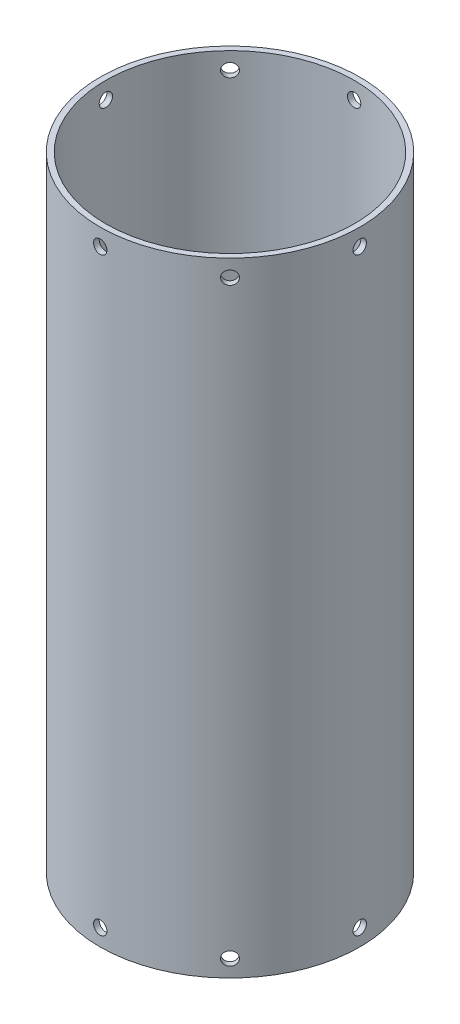
from build123d import *

# Parameters (mm, degrees)
SKETCH1_R               = 97.52457
SKETCH1_R_2             = 93.298518
BOSS_EXTRUDE1_DEPTH     = 467.995
CUT_EXTRUDE1_REACH      = 465.586
CUT_EXTRUDE1_END_RADIUS = 97.52457
SKETCH4_R               = 5.0165
CIRPATTERN3_COUNT       = 8
CUT_EXTRUDE2_REACH      = 465.586
CUT_EXTRUDE2_END_RADIUS = 97.52457
SKETCH7_R               = 5.0165
CIRPATTERN4_COUNT       = 8
SCALE1_SCALE            = 0.390667


with BuildPart() as part:
    # Sketch1 → Boss-Extrude1 (new body)
    with BuildSketch(Plane(origin=(0, 0, 0), x_dir=(1, 0, 0), z_dir=(0, 1, 0))):
        with Locations(Location((0, 0, 0), (0, 0, 270))):
            Circle(SKETCH1_R)
        with Locations(Location((0, 0, 0), (0, 0, 270))):
            Circle(SKETCH1_R_2, mode=Mode.SUBTRACT)
    extrude(amount=BOSS_EXTRUDE1_DEPTH)

    # Cut-Extrude1: up to this cylinder (the profile starts inside it)
    cut_extrude1_end = Plane(origin=(0, 455.295, 0), z_dir=(0, -1, 0)) * Cylinder(CUT_EXTRUDE1_END_RADIUS, 1127.22114, mode=Mode.PRIVATE)
    # Sketch4 → Cut-Extrude1 (cut, up to the surface)
    with BuildSketch(Plane(origin=(0, 442.595, 0), x_dir=(0, 0, 1), z_dir=(1, 0, 0)), mode=Mode.PRIVATE) as cut_extrude1_sk1:
        with Locations((0, -12.7)):
            Circle(SKETCH4_R)
    cut_extrude1_tool1 = extrude(cut_extrude1_sk1.sketch, amount=CUT_EXTRUDE1_REACH, mode=Mode.PRIVATE) & cut_extrude1_end
    cut_extrude1 = cut_extrude1_tool1.solids().sort_by_distance((0, 455.295, 0))[0]
    add(cut_extrude1, mode=Mode.SUBTRACT)

    # CirPattern3: Cut-Extrude1 ×8 about axis
    cirpattern3_axis = Axis((0, 467.995, 0), (0, 1, 0))
    for i in range(1, CIRPATTERN3_COUNT):
        add(cut_extrude1.rotate(cirpattern3_axis, i * 360 / CIRPATTERN3_COUNT), mode=Mode.SUBTRACT)

    # Cut-Extrude2: up to this cylinder (the profile starts inside it)
    cut_extrude2_end = Plane(origin=(0, 12.7, 0), z_dir=(0, -1, 0)) * Cylinder(CUT_EXTRUDE2_END_RADIUS, 1127.22114, mode=Mode.PRIVATE)
    # Sketch7 → Cut-Extrude2 (cut, up to the surface)
    with BuildSketch(Plane(origin=(0, 25.4, 0), x_dir=(0, 0, -1), z_dir=(1, 0, 0)), mode=Mode.PRIVATE) as cut_extrude2_sk1:
        with Locations(Location((0, -12.7, 0), (0, 0, 180))):
            Circle(SKETCH7_R)
    cut_extrude2_tool1 = extrude(cut_extrude2_sk1.sketch, amount=CUT_EXTRUDE2_REACH, mode=Mode.PRIVATE) & cut_extrude2_end
    cut_extrude2 = cut_extrude2_tool1.solids().sort_by_distance((0, 12.7, 0))[0]
    add(cut_extrude2, mode=Mode.SUBTRACT)

    # CirPattern4: Cut-Extrude2 ×8 about axis
    cirpattern4_axis = Axis((0, 0, 0), (0, 1, 0))
    for i in range(1, CIRPATTERN4_COUNT):
        add(cut_extrude2.rotate(cirpattern4_axis, i * 360 / CIRPATTERN4_COUNT), mode=Mode.SUBTRACT)


with BuildPart() as part_1:
    # Scale1: scaled about (0, 233.9975, 0)
    add(part.part.scale(SCALE1_SCALE).moved(Location((0, 142.582398668, 0))))


solid = part_1.part
